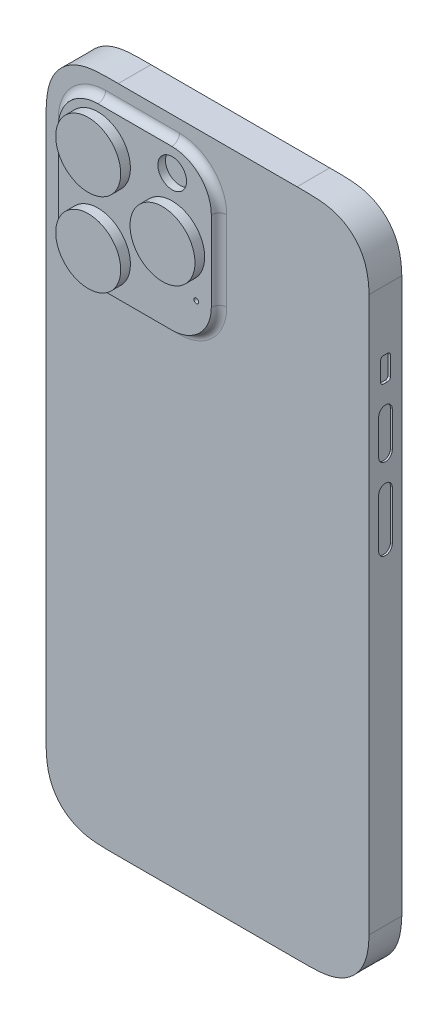
from build123d import *

# Parameters (mm, degrees)
EXTRUDE_1_DEPTH     = 7.85
CUT_EXTRUDE_1_DEPTH = 0.001
CUT_EXTRUDE_2_DEPTH = 0.01
CUT_EXTRUDE_3_DEPTH = 0.1
SKETCH_8_R          = 0.765
SKETCH_8_R_2        = 0.7525
SKETCH_8_R_3        = 0.75
CUT_EXTRUDE_5_DEPTH = 3
SKETCH_10_R         = 3.45
SKETCH_10_R_2       = 0.575
EXTRUDE_2_DEPTH     = 1.85
SKETCH_11_R         = 7.805
EXTRUDE_3_DEPTH     = 4.18
FILLET_1_R          = 1.85
CUT_EXTRUDE_6_DEPTH = 0.45
CUT_EXTRUDE_7_DEPTH = 0.6
SKETCH_15_W         = 0.041920546
SKETCH_15_H         = 0.312175412
SKETCH_15_W_2       = 0.736326987
SKETCH_15_H_2       = 1.532152515
CUT_EXTRUDE_8_DEPTH = 0.45


with BuildPart() as part:
    # 草图1 → 凸台-拉伸1 (new body)
    with BuildSketch(Plane.XY):
        with BuildLine():
            Line((-13.060149191, 137.861995763), (-56.000149191, 137.861995763))
            add(Edge.make_bspline(
                [(-73.320149191, 124.100614961), (-73.261425054, 126.544642919), (-72.71871985, 130.625843629), (-69.278005056, 135.103370788), (-63.771221959, 138.07338353), (-58.988608176, 137.839010712), (-56.000149191, 137.861995763)],
                knots=[0.066006198, 0.066006198, 0.066006198, 0.066006198, 0.333631283, 0.499508511, 0.665642606, 1, 1, 1, 1], degree=3))
            Line((-73.320149191, 124.100614961), (-73.320149191, 122.311995763))
            Line((-73.320149191, 122.311995763), (-73.320149191, -7.298004237))
            Line((-73.320149191, -7.298004237), (-73.320149191, -9.086623436))
            add(Edge.make_bspline(
                [(-73.320149191, -9.086623436), (-73.261425054, -11.530651394), (-72.71871985, -15.611852104), (-69.278005056, -20.089379263), (-63.771221959, -23.059392005), (-58.988608176, -22.825019187), (-56.000149191, -22.848004237)],
                knots=[0.066006198, 0.066006198, 0.066006198, 0.066006198, 0.333631283, 0.499508511, 0.665642606, 1, 1, 1, 1], degree=3))
            Line((-56.000149191, -22.848004237), (-13.060149191, -22.848004237))
            add(Edge.make_bspline(
                [(4.259850809, -9.086623436), (4.201126671, -11.530651394), (3.658421468, -15.611852104), (0.217706674, -20.089379263), (-5.289076424, -23.059392005), (-10.071690207, -22.825019187), (-13.060149191, -22.848004237)],
                knots=[0.066006198, 0.066006198, 0.066006198, 0.066006198, 0.333631283, 0.499508511, 0.665642606, 1, 1, 1, 1], degree=3))
            Line((4.259850809, -9.086623436), (4.259850809, -7.298004237))
            Line((4.259850809, -7.298004237), (4.259850809, 122.311995763))
            Line((4.259850809, 122.311995763), (4.259850809, 124.100614961))
            add(Edge.make_bspline(
                [(4.259850809, 124.100614961), (4.201126671, 126.544642919), (3.658421468, 130.625843629), (0.217706674, 135.103370788), (-5.289076424, 138.07338353), (-10.071690207, 137.839010712), (-13.060149191, 137.861995763)],
                knots=[0.066006198, 0.066006198, 0.066006198, 0.066006198, 0.333631283, 0.499508511, 0.665642606, 1, 1, 1, 1], degree=3))
        make_face()
    extrude(amount=EXTRUDE_1_DEPTH)

    # 草图2 → 切除-拉伸1 (cut)
    with BuildSketch(Plane.XY):
        with BuildLine():
            Line((3.209850809, -9.073907647), (3.209850809, 124.087899172))
            add(Edge.make_bspline(
                [(3.209850809, 124.087899172), (3.185385806, 125.089625101), (3.11408329, 126.082833034), (2.811335469, 128.040124905), (2.581418305, 129.004486754), (2.128782387, 130.179888175), (2.029393058, 130.414172056), (1.815366404, 130.870948532), (1.700356998, 131.09424941), (1.331890637, 131.749239951), (1.055327608, 132.166228793), (0.440014267, 132.960640946), (0.098482142, 133.340102168), (-0.628492911, 134.03320368), (-1.016103709, 134.349031784), (-1.631929319, 134.77895118), (-1.842897653, 134.91500705), (-2.276030597, 135.17285956), (-2.498934537, 135.294980972), (-3.175134626, 135.635420673), (-3.637849447, 135.829472073), (-4.585853948, 136.155223438), (-5.071460635, 136.286047835), (-6.061546104, 136.495572174), (-6.558633329, 136.572957107), (-8.052344067, 136.747320737), (-9.052396844, 136.787335474), (-11.055341782, 136.816385426), (-12.058290982, 136.804396536), (-13.060149191, 136.811995763)],
                knots=[0, 0, 0, 0, 0.125, 0.125, 0.25, 0.25, 0.28125, 0.28125, 0.3125, 0.3125, 0.375, 0.375, 0.4375, 0.4375, 0.5, 0.5, 0.53125, 0.53125, 0.5625, 0.5625, 0.625, 0.625, 0.6875, 0.6875, 0.75, 0.75, 0.875, 0.875, 1, 1, 1, 1], degree=3))
            Line((-13.060149191, 136.811995763), (-55.992073595, 136.812026818))
            add(Edge.make_bspline(
                [(-55.992073595, 136.812026818), (-56.994218884, 136.804319046), (-57.996934594, 136.816340576), (-60.00083829, 136.787543855), (-61.00295038, 136.747736441), (-62.999092985, 136.515011355), (-63.977697114, 136.323299841), (-65.158833666, 135.920637615), (-65.392986444, 135.832075556), (-65.857003144, 135.638351139), (-66.087260199, 135.532918954), (-66.760999131, 135.195805276), (-67.190928739, 134.942211461), (-68.010611587, 134.374744985), (-68.400147688, 134.060546538), (-69.134822063, 133.365537104), (-69.471240748, 132.99413703), (-70.085575533, 132.208652812), (-70.363729927, 131.794311654), (-70.736424415, 131.139643775), (-70.853574468, 130.914921197), (-71.069544512, 130.459736006), (-71.168630236, 130.229191452), (-71.441963916, 129.529622203), (-71.592375876, 129.052690942), (-71.841828313, 128.081788144), (-71.94099592, 127.58627221), (-72.173926697, 126.096098707), (-72.245567921, 125.094337266), (-72.270149191, 124.087899172)],
                knots=[0, 0, 0, 0, 0.125, 0.125, 0.25, 0.25, 0.375, 0.375, 0.40625, 0.40625, 0.4375, 0.4375, 0.5, 0.5, 0.5625, 0.5625, 0.625, 0.625, 0.6875, 0.6875, 0.71875, 0.71875, 0.75, 0.75, 0.8125, 0.8125, 0.875, 0.875, 1, 1, 1, 1], degree=3))
            Line((-72.270149191, 124.087899172), (-72.270149191, -9.073907647))
            add(Edge.make_bspline(
                [(-72.270149191, -9.073907647), (-72.245684189, -10.075633576), (-72.174381672, -11.068841509), (-71.871633852, -13.02613338), (-71.641716687, -13.990495229), (-71.189080769, -15.16589665), (-71.089691441, -15.400180531), (-70.875664786, -15.856957007), (-70.760655381, -16.080257885), (-70.39218902, -16.735248426), (-70.115625991, -17.152237268), (-69.50031265, -17.946649421), (-69.158780525, -18.326110643), (-68.431805472, -19.019212155), (-68.044194673, -19.335040259), (-67.428369064, -19.764959655), (-67.21740073, -19.901015525), (-66.784267785, -20.158868035), (-66.561363846, -20.280989446), (-65.885163757, -20.621429148), (-65.422448936, -20.815480548), (-64.474444435, -21.141231913), (-63.988837747, -21.272056309), (-62.998752278, -21.481580649), (-62.501665053, -21.558965582), (-61.007954316, -21.733329212), (-60.007901538, -21.773343949), (-58.004956601, -21.802393901), (-57.002007401, -21.790405011), (-56.000149191, -21.798004237)],
                knots=[0, 0, 0, 0, 0.125, 0.125, 0.25, 0.25, 0.28125, 0.28125, 0.3125, 0.3125, 0.375, 0.375, 0.4375, 0.4375, 0.5, 0.5, 0.53125, 0.53125, 0.5625, 0.5625, 0.625, 0.625, 0.6875, 0.6875, 0.75, 0.75, 0.875, 0.875, 1, 1, 1, 1], degree=3))
            Line((-56.000149191, -21.798004237), (-13.068224788, -21.798035293))
            add(Edge.make_bspline(
                [(-13.068224788, -21.798035293), (-12.066079499, -21.790327521), (-11.063363789, -21.802349051), (-9.059460092, -21.77355233), (-8.057348003, -21.733744916), (-6.061205398, -21.50101983), (-5.082601269, -21.309308315), (-3.901464717, -20.906646089), (-3.667311939, -20.818084031), (-3.203295239, -20.624359614), (-2.973038184, -20.518927429), (-2.299299252, -20.18181375), (-1.869369644, -19.928219936), (-1.049686796, -19.360753459), (-0.660150694, -19.046555013), (0.07452368, -18.351545579), (0.410942365, -17.980145505), (1.02527715, -17.194661287), (1.303431545, -16.780320129), (1.676126032, -16.12565225), (1.793276085, -15.900929671), (2.009246129, -15.445744481), (2.108331853, -15.215199927), (2.381665533, -14.515630678), (2.532077493, -14.038699417), (2.78152993, -13.067796619), (2.880697537, -12.572280685), (3.113628314, -11.082107182), (3.185269539, -10.080345741), (3.209850809, -9.073907647)],
                knots=[0, 0, 0, 0, 0.125, 0.125, 0.25, 0.25, 0.375, 0.375, 0.40625, 0.40625, 0.4375, 0.4375, 0.5, 0.5, 0.5625, 0.5625, 0.625, 0.625, 0.6875, 0.6875, 0.71875, 0.71875, 0.75, 0.75, 0.8125, 0.8125, 0.875, 0.875, 1, 1, 1, 1], degree=3))
        make_face()
    extrude(amount=CUT_EXTRUDE_1_DEPTH, mode=Mode.SUBTRACT)

    # 草图5 → 切除-拉伸2 (cut)
    with BuildSketch(Plane.XY):
        with BuildLine():
            Line((-56.000146887, -18.613004237), (-13.092720764, -18.613129494))
            add(Edge.make_bspline(
                [(-13.092720764, -18.613129494), (-12.307519002, -18.607090294), (-11.521279848, -18.613083088), (-9.950515821, -18.605185905), (-9.165931815, -18.591981767), (-7.603445206, -18.488080457), (-6.825337543, -18.399761646), (-5.66958591, -18.134948216), (-5.284491967, -18.022776258), (-4.527899798, -17.735650723), (-4.164394678, -17.565421446), (-3.468150883, -17.169494322), (-3.134010389, -16.942551701), (-2.508533038, -16.427636576), (-2.224344142, -16.145261984), (-1.707475342, -15.535557951), (-1.47376797, -15.207352659), (-1.062670505, -14.509264275), (-0.89085176, -14.146420007), (-0.604036731, -13.397483484), (-0.487589443, -13.010476024), (-0.297284434, -12.225965457), (-0.22382391, -11.831046365), (-0.049918819, -10.640581704), (0.004124227, -9.839337958), (0.024850809, -9.034002899)],
                knots=[0, 0, 0, 0, 0.125, 0.125, 0.25, 0.25, 0.375, 0.375, 0.4375, 0.4375, 0.5, 0.5, 0.5625, 0.5625, 0.625, 0.625, 0.6875, 0.6875, 0.75, 0.75, 0.8125, 0.8125, 0.875, 0.875, 1, 1, 1, 1], degree=3))
            Line((0.024850809, -9.034002899), (0.024850809, 124.047989401))
            add(Edge.make_bspline(
                [(0.024850809, 124.047989401), (0.004323223, 124.845485757), (-0.048940175, 125.638712174), (-0.219046605, 126.816784963), (-0.290417568, 127.207562546), (-0.475703349, 127.983568446), (-0.590428129, 128.369341929), (-0.870411628, 129.11305194), (-1.037298243, 129.472653837), (-1.435298978, 130.162596039), (-1.666770655, 130.495047878), (-2.174589175, 131.105848948), (-2.452152271, 131.387915128), (-3.059134346, 131.90089199), (-3.391228577, 132.133350387), (-4.079855308, 132.536427345), (-4.438086177, 132.709490663), (-5.180641045, 133.002230843), (-5.567100482, 133.120723712), (-6.727003236, 133.399028828), (-7.511245863, 133.492905484), (-9.088938039, 133.603759035), (-9.88312636, 133.618383603), (-11.471624579, 133.627449487), (-12.265906175, 133.621205484), (-13.060151495, 133.626995763)],
                knots=[0, 0, 0, 0, 0.125, 0.125, 0.1875, 0.1875, 0.25, 0.25, 0.3125, 0.3125, 0.375, 0.375, 0.4375, 0.4375, 0.5, 0.5, 0.5625, 0.5625, 0.625, 0.625, 0.75, 0.75, 0.875, 0.875, 1, 1, 1, 1], degree=3))
            Line((-13.060151495, 133.626995763), (-55.967577619, 133.627121019))
            add(Edge.make_bspline(
                [(-55.967577619, 133.627121019), (-56.752779381, 133.621081819), (-57.539018535, 133.627074613), (-59.109782562, 133.61917743), (-59.894366568, 133.605973292), (-61.456853176, 133.502071982), (-62.23496084, 133.413753171), (-63.390712472, 133.148939741), (-63.775806415, 133.036767783), (-64.532398585, 132.749642248), (-64.895903704, 132.579412971), (-65.5921475, 132.183485847), (-65.926287993, 131.956543226), (-66.551765345, 131.441628101), (-66.83595424, 131.159253509), (-67.352823041, 130.549549476), (-67.586530412, 130.221344184), (-67.997627878, 129.5232558), (-68.169446622, 129.160411532), (-68.456261652, 128.411475009), (-68.57270894, 128.024467549), (-68.763013948, 127.239956982), (-68.836474473, 126.84503789), (-69.010379563, 125.654573229), (-69.064422609, 124.853329483), (-69.085149191, 124.047994424)],
                knots=[0, 0, 0, 0, 0.125, 0.125, 0.25, 0.25, 0.375, 0.375, 0.4375, 0.4375, 0.5, 0.5, 0.5625, 0.5625, 0.625, 0.625, 0.6875, 0.6875, 0.75, 0.75, 0.8125, 0.8125, 0.875, 0.875, 1, 1, 1, 1], degree=3))
            Line((-69.085149191, 124.047994424), (-69.085149191, -9.033997876))
            add(Edge.make_bspline(
                [(-69.085149191, -9.033997876), (-69.064621606, -9.831494232), (-69.011358208, -10.624720649), (-68.841251778, -11.802793438), (-68.769880815, -12.19357102), (-68.584595033, -12.969576921), (-68.469870253, -13.355350404), (-68.189886755, -14.099060415), (-68.02300014, -14.458662312), (-67.624999405, -15.148604514), (-67.393527728, -15.481056353), (-66.885709207, -16.091857423), (-66.608146112, -16.373923603), (-66.001164037, -16.886900465), (-65.669069805, -17.119358861), (-64.980443074, -17.52243582), (-64.622212206, -17.695499138), (-63.879657338, -17.988239318), (-63.493197901, -18.106732187), (-62.333295147, -18.385037303), (-61.54905252, -18.478913959), (-59.971360344, -18.58976751), (-59.177172023, -18.604392078), (-57.588673803, -18.613457962), (-56.794392207, -18.607213959), (-56.000146887, -18.613004237)],
                knots=[0, 0, 0, 0, 0.125, 0.125, 0.1875, 0.1875, 0.25, 0.25, 0.3125, 0.3125, 0.375, 0.375, 0.4375, 0.4375, 0.5, 0.5, 0.5625, 0.5625, 0.625, 0.625, 0.75, 0.75, 0.875, 0.875, 1, 1, 1, 1], degree=3))
        make_face()
    extrude(amount=CUT_EXTRUDE_2_DEPTH, mode=Mode.SUBTRACT)

    # 草图6 → 切除-拉伸3 (cut)
    with BuildSketch(Plane.XY):
        with BuildLine():
            Line((-28.545698658, 136.966995763), (-42.755698658, 136.966995763))
            Line((-42.755698658, 136.966995763), (-42.755698658, 136.591995763))
            ThreePointArc((-42.755698658, 136.591995763), (-42.645863701, 136.32683072), (-42.380698658, 136.216995763))
            Line((-42.380698658, 136.216995763), (-28.920698658, 136.216995763))
            ThreePointArc((-28.920698658, 136.216995763), (-28.655533615, 136.32683072), (-28.545698658, 136.591995763))
            Line((-28.545698658, 136.591995763), (-28.545698658, 136.966995763))
        make_face()
    extrude(amount=CUT_EXTRUDE_3_DEPTH, mode=Mode.SUBTRACT)

    # 草图8 → 切除-拉伸5 (cut)
    with BuildSketch(Plane.XZ.offset(22.848004237)):
        with Locations((-54.210149191, 3.925)):
            Circle(SKETCH_8_R)
        with Locations((-51.935149191, 3.925)):
            Circle(SKETCH_8_R)
        with Locations((-49.660149191, 3.925)):
            Circle(SKETCH_8_R)
        with Locations((-47.385149191, 3.925)):
            Circle(SKETCH_8_R)
        with Locations((-23.950149191, 3.925)):
            Circle(SKETCH_8_R)
        with Locations((-21.390149191, 3.925)):
            Circle(SKETCH_8_R)
        with Locations((-18.830149191, 3.925)):
            Circle(SKETCH_8_R)
        with Locations((-16.270149191, 3.925)):
            Circle(SKETCH_8_R)
        with Locations((-13.710149191, 3.925)):
            Circle(SKETCH_8_R)
        with Locations((-11.150149191, 3.925)):
            Circle(SKETCH_8_R)
        with Locations((-40.930149191, 3.925)):
            Circle(SKETCH_8_R_2)
        with Locations((-28.767318137, 3.925)):
            Circle(SKETCH_8_R_3)
        with BuildLine():
            Line((-37.380149191, 5.475), (-32.317318137, 5.475))
            ThreePointArc((-32.317318137, 5.475), (-30.767318137, 3.925), (-32.317318137, 2.375))
            Line((-32.317318137, 2.375), (-37.380149191, 2.375))
            ThreePointArc((-37.380149191, 2.375), (-38.930149191, 3.925), (-37.380149191, 5.475))
        make_face()
    extrude(amount=-CUT_EXTRUDE_5_DEPTH, mode=Mode.SUBTRACT)

    # 草图10 → 凸台-拉伸2 (add)
    with BuildSketch(Plane.XY.offset(7.85)):
        with BuildLine():
            Line((-59.040149191, 133.071995763), (-41.290149191, 133.071995763))
            ThreePointArc((-41.290149191, 133.071995763), (-34.579705838, 130.292439116), (-31.800149191, 123.581995763))
            Line((-31.800149191, 123.581995763), (-31.800149191, 104.341995763))
            ThreePointArc((-31.800149191, 104.341995763), (-34.579705838, 97.631552409), (-41.290149191, 94.851995763))
            Line((-41.290149191, 94.851995763), (-59.040149191, 94.851995763))
            ThreePointArc((-59.040149191, 94.851995763), (-65.750592545, 97.631552409), (-68.530149191, 104.341995763))
            Line((-68.530149191, 104.341995763), (-68.530149191, 123.581995763))
            ThreePointArc((-68.530149191, 123.581995763), (-65.750592545, 130.292439116), (-59.040149191, 133.071995763))
        make_face()
        with Locations((-41.200149191, 127.541995763)):
            Circle(SKETCH_10_R, mode=Mode.SUBTRACT)
        with Locations((-35.410149191, 103.881995763)):
            Circle(SKETCH_10_R_2, mode=Mode.SUBTRACT)
    extrude(amount=EXTRUDE_2_DEPTH)

    # 草图11 → 凸台-拉伸3 (add)
    with BuildSketch(Plane.XY.offset(7.85)):
        with Locations((-59.040149191, 123.581995763)):
            Circle(SKETCH_11_R)
        with Locations((-59.040149191, 103.570701493)):
            Circle(SKETCH_11_R)
        with Locations((-41.200149191, 113.961995763)):
            Circle(SKETCH_11_R)
    extrude(amount=EXTRUDE_3_DEPTH)

    # 圆角1
    fillet_1_edges = [part.edges().sort_by_distance(p)[0] for p in [
        (-31.800149191, 113.961995763, 7.85),
        (-34.579705838, 97.631552409, 7.85),
        (-50.165149191, 94.851995763, 7.85),
        (-65.750592545, 97.631552409, 7.85),
        (-68.530149191, 113.961995763, 7.85),
        (-65.750592545, 130.292439116, 7.85),
        (-50.165149191, 133.071995763, 7.85),
        (-34.579705838, 130.292439116, 7.85),
    ]]
    fillet(fillet_1_edges, radius=FILLET_1_R - 0.0001)  # a hair under: the kernel refuses the full size

    # 草图12 → 切除-拉伸6 (cut)
    with BuildSketch(Plane.ZY.offset(73.320149191)):
        with BuildLine():
            Line((5.52, 91.471995763), (5.52, 73.171995763))
            ThreePointArc((5.52, 73.171995763), (3.89, 71.541995763), (2.26, 73.171995763))
            Line((2.26, 73.171995763), (2.26, 91.471995763))
            ThreePointArc((2.26, 91.471995763), (3.89, 93.101995763), (5.52, 91.471995763))
        make_face()
    extrude(amount=-CUT_EXTRUDE_6_DEPTH, mode=Mode.SUBTRACT)

    # 草图13 → 切除-拉伸7 (cut)
    with BuildSketch(Plane(origin=(4.259850809, 0, 0), x_dir=(0, 0, -1), z_dir=(1, 0, 0))):
        with BuildLine():
            Line((-4.45, 109.681995763), (-3.4, 109.681995763))
            ThreePointArc((-3.4, 109.681995763), (-2.940380592, 109.49161517), (-2.75, 109.031995763))
            Line((-2.75, 109.031995763), (-2.75, 104.411995763))
            ThreePointArc((-2.75, 104.411995763), (-2.940380592, 103.952376355), (-3.4, 103.761995763))
            Line((-3.4, 103.761995763), (-4.45, 103.761995763))
            ThreePointArc((-4.45, 103.761995763), (-4.909619408, 103.952376355), (-5.1, 104.411995763))
            Line((-5.1, 104.411995763), (-5.1, 109.031995763))
            ThreePointArc((-5.1, 109.031995763), (-4.909619408, 109.49161517), (-4.45, 109.681995763))
        make_face()
    extrude(amount=-CUT_EXTRUDE_7_DEPTH, mode=Mode.SUBTRACT)

    # 草图15 → 切除-拉伸8 (cut)
    with BuildSketch(Plane(origin=(4.259850809, 0, 0), x_dir=(0, 0, -1), z_dir=(1, 0, 0))):
        with BuildLine():
            Line((-2.295, 97.541995763), (-2.295, 89.001995763))
            ThreePointArc((-2.295, 89.001995763), (-3.925, 87.371995763), (-5.555, 89.001995763))
            Line((-5.555, 89.001995763), (-5.555, 97.541995763))
            ThreePointArc((-5.555, 97.541995763), (-3.925, 99.171995763), (-2.295, 97.541995763))
        make_face()
        with BuildLine():
            Line((-2.295, 81.271995763), (-2.295, 69.471995763))
            ThreePointArc((-2.295, 69.471995763), (-3.925, 67.841995763), (-5.555, 69.471995763))
            Line((-5.555, 69.471995763), (-5.555, 81.271995763))
            ThreePointArc((-5.555, 81.271995763), (-3.925, 82.901995763), (-2.295, 81.271995763))
        make_face()
        with Locations((-29.524668901, 136.591302512)):
            Rectangle(SKETCH_15_W, SKETCH_15_H)
        with Locations((-17.647499575, 137.35737877)):
            Rectangle(SKETCH_15_W_2, SKETCH_15_H_2)
    extrude(amount=-CUT_EXTRUDE_8_DEPTH, mode=Mode.SUBTRACT)


solid = part.part
